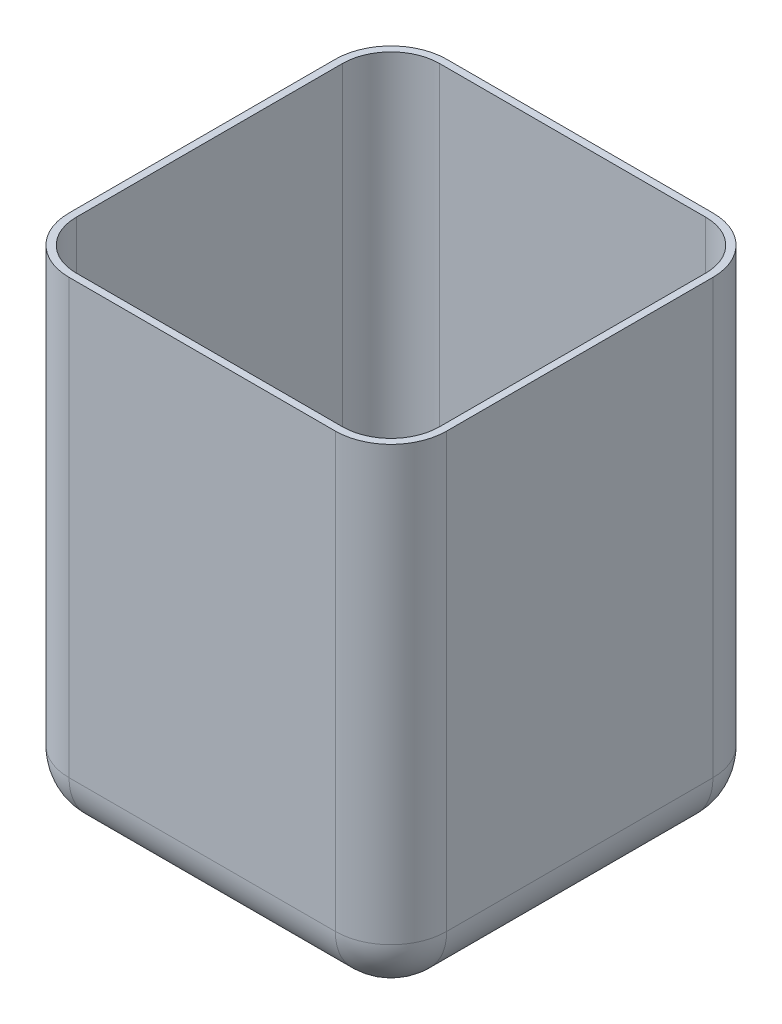
from build123d import *

# Parameters (mm, degrees)
SKETCH1_W           = 156
SKETCH1_H           = 156
BOSS_EXTRUDE1_DEPTH = 202
FILLET1_R           = 23
SHELL1_T            = -3


with BuildPart() as part:
    # Sketch1 → Boss-Extrude1 (new body)
    with BuildSketch(Plane(origin=(0, 0, 0), x_dir=(1, 0, 0), z_dir=(0, 1, 0))):
        with Locations((8.769230769, -22.609756098)):
            Rectangle(SKETCH1_W, SKETCH1_H)
    extrude(amount=BOSS_EXTRUDE1_DEPTH)

    # Fillet1
    fillet1_edges = [part.edges().sort_by_distance(p)[0] for p in [
        (8.769230769, 0, 100.609756098),
        (86.769230769, 0, 22.609756098),
        (8.769230769, 0, -55.390243902),
        (-69.230769231, 0, 22.609756098),
        (86.769230769, 101, -55.390243902),
        (-69.230769231, 101, -55.390243902),
        (86.769230769, 101, 100.609756098),
        (-69.230769231, 101, 100.609756098),
    ]]
    fillet(fillet1_edges, radius=FILLET1_R)

    # Shell1
    shell1_openings = [part.faces().sort_by_distance(p)[0] for p in [
        (8.769230769, 202, 22.609756098),
    ]]
    offset(amount=SHELL1_T, openings=shell1_openings, kind=Kind.INTERSECTION)


solid = part.part
